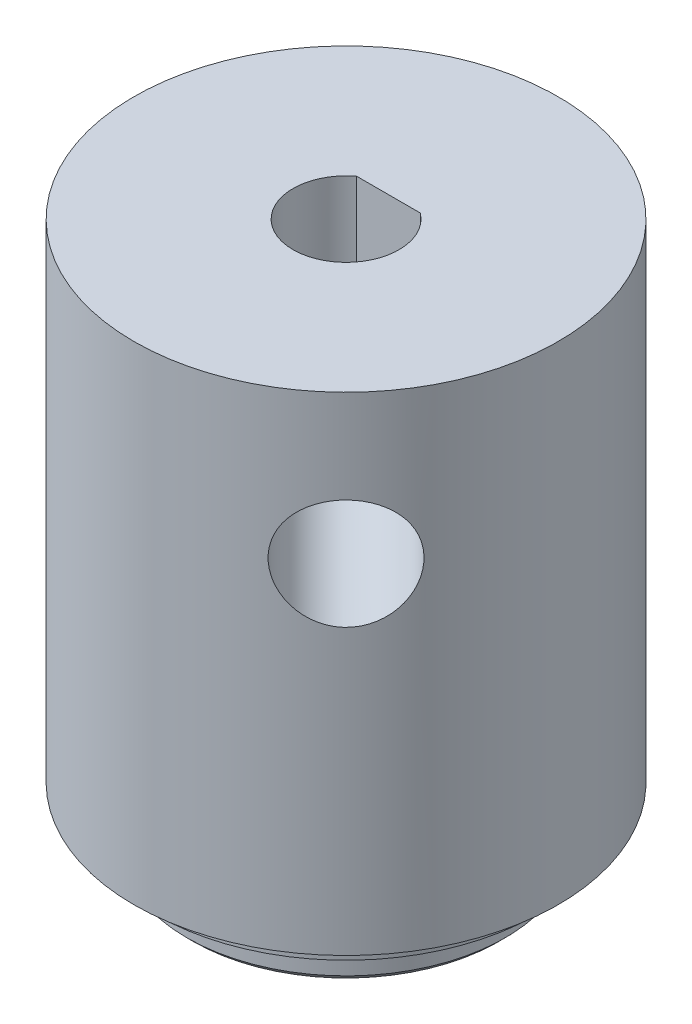
from build123d import *

# Parameters (mm, degrees)
SKETCH1_R             = 7.5
BOSS_EXTRUDE1_DEPTH   = 2
SKETCH2_R             = 9
BOSS_EXTRUDE2_DEPTH   = 0.9
SKETCH3_R             = 10
BOSS_EXTRUDE3_DEPTH   = 23
SKETCH5_R             = 2.1
CUT_EXTRUDE1_DEPTH    = 5.5
CUT_EXTRUDE2_DEPTH    = 20
SKETCH7_R             = 2.6
CUT_EXTRUDE3_DEPTH    = 30.509489999
CIRPATTERN1_OUTLINE_R = 2.6
CIRPATTERN1_DEPTH     = 10.0000001
CHAMFER1_SIZE         = 0.3


# Read off the part's stored shape, not the designer's step: CirPattern1
with BuildPart() as part:
    # Sketch1 → Boss-Extrude1 (new body)
    with BuildSketch(Plane(origin=(0, 0, 0), x_dir=(1, 0, 0), z_dir=(0, 1, 0))):
        with Locations(Location((0, 0, 0), (0, 0, 270))):
            Circle(SKETCH1_R)
    extrude(amount=BOSS_EXTRUDE1_DEPTH)

    # Sketch2 → Boss-Extrude2 (add)
    with BuildSketch(Plane(origin=(0, 2, 0), x_dir=(1, 0, 0), z_dir=(0, 1, 0))):
        with Locations(Location((0, 0, 0), (0, 0, 270))):
            Circle(SKETCH2_R)
    extrude(amount=BOSS_EXTRUDE2_DEPTH)

    # Sketch3 → Boss-Extrude3 (add)
    with BuildSketch(Plane(origin=(0, 2.9, 0), x_dir=(1, 0, 0), z_dir=(0, 1, 0))):
        with Locations(Location((0, 0, 0), (0, 0, 270))):
            Circle(SKETCH3_R)
    extrude(amount=BOSS_EXTRUDE3_DEPTH)

    # Sketch5 → Cut-Extrude1 (cut)
    with BuildSketch(Plane.XZ):
        with Locations(Location((4, 0, 0), (0, 0, 270))):
            Circle(SKETCH5_R)
        with Locations(Location((-2, -3.464101615, 0), (0, 0, 270))):
            Circle(SKETCH5_R)
        with Locations(Location((-2, 3.464101615, 0), (0, 0, 270))):
            Circle(SKETCH5_R)
    extrude(amount=-CUT_EXTRUDE1_DEPTH, mode=Mode.SUBTRACT)

    # Sketch6 → Cut-Extrude2 (cut)
    with BuildSketch(Plane(origin=(0, 25.9, 0), x_dir=(1, 0, 0), z_dir=(0, 1, 0))):
        with BuildLine():
            Line((-1.5, 2), (1.5, 2))
            ThreePointArc((1.5, 2), (0, -2.5), (-1.5, 2))
        make_face()
    extrude(amount=-CUT_EXTRUDE2_DEPTH, mode=Mode.SUBTRACT)

    # Sketch7 → Cut-Extrude3 (cut, through all)
    with BuildSketch(Plane.XY):
        with Locations(Location((0, 18.9, 0), (0, 0, 344.057631394))):
            Circle(SKETCH7_R)
    extrude(amount=-CUT_EXTRUDE3_DEPTH, mode=Mode.SUBTRACT)

    # CirPattern1 outline → CirPattern1 (cut)
    with BuildSketch(Plane(origin=(0, 0, 0), x_dir=(0.7071067811865509, 0, -0.707106781186544), z_dir=(0.707106781186544, 0, 0.707106781186551))):
        with Locations((0, 18.9)):
            Circle(CIRPATTERN1_OUTLINE_R)
    extrude(amount=CIRPATTERN1_DEPTH, mode=Mode.SUBTRACT)

    # Chamfer1
    chamfer1_edges = [part.edges().sort_by_distance(p)[0] for p in [
        (0, 0, -7.5),
    ]]
    chamfer(chamfer1_edges, length=CHAMFER1_SIZE)


solid = part.part
